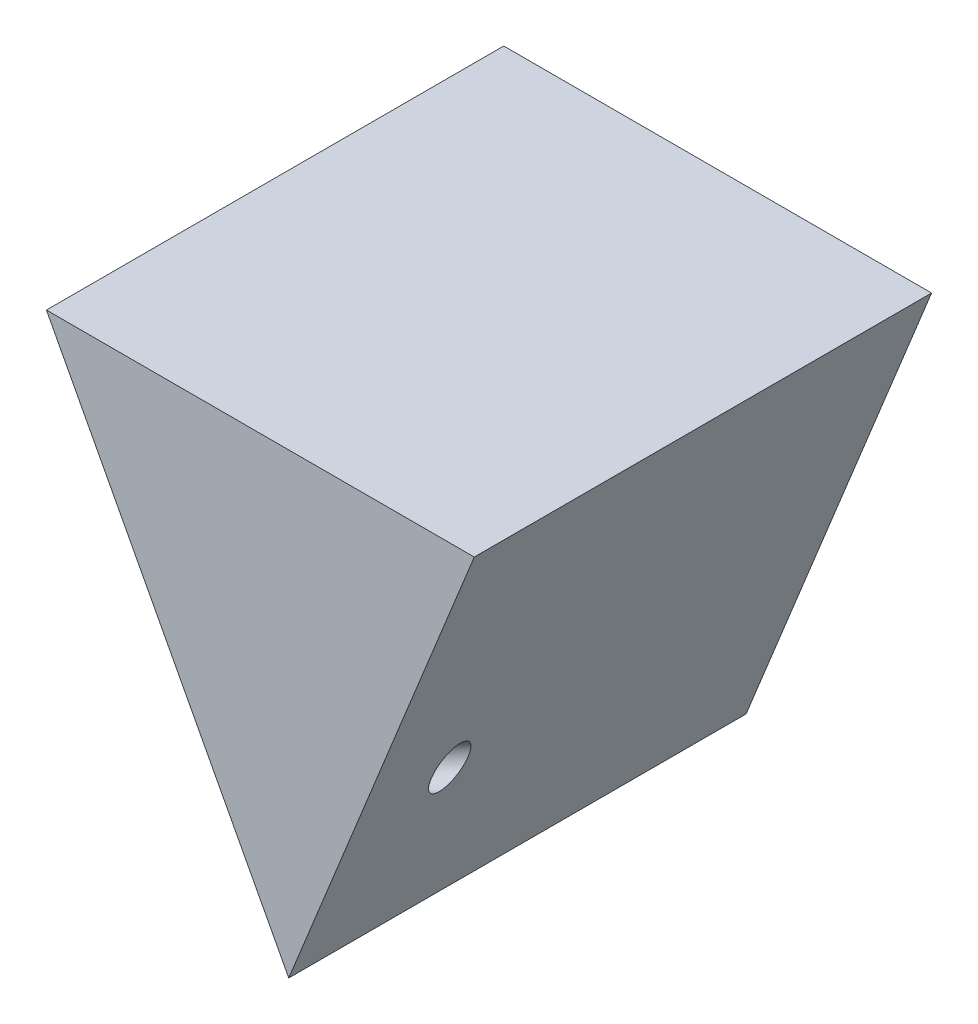
from build123d import *

# Parameters (mm, degrees)
BOSS_EXTRUDE1_DEPTH = 50
SKETCH2_R           = 2
CUT_EXTRUDE1_DEPTH  = 50


with BuildPart() as part:
    # Sketch1 → Boss-Extrude1 (new body)
    with BuildSketch(Plane.XY):
        Polygon((-36.238637744, 19.241346543), (-9.742760301, -30.758653457), (10.539906282, 19.241346543), align=None)
    extrude(amount=BOSS_EXTRUDE1_DEPTH)

    # Sketch2 → Cut-Extrude1 (cut)
    with BuildSketch(Plane(origin=(-20.332646925, -10.77462642, 0), x_dir=(0, 0, 1), z_dir=(-0.8836030430860087, -0.46823675875474063, 0))):
        with Locations((40, -9.616521291)):
            Circle(SKETCH2_R)
    extrude(amount=-CUT_EXTRUDE1_DEPTH, mode=Mode.SUBTRACT)


solid = part.part
